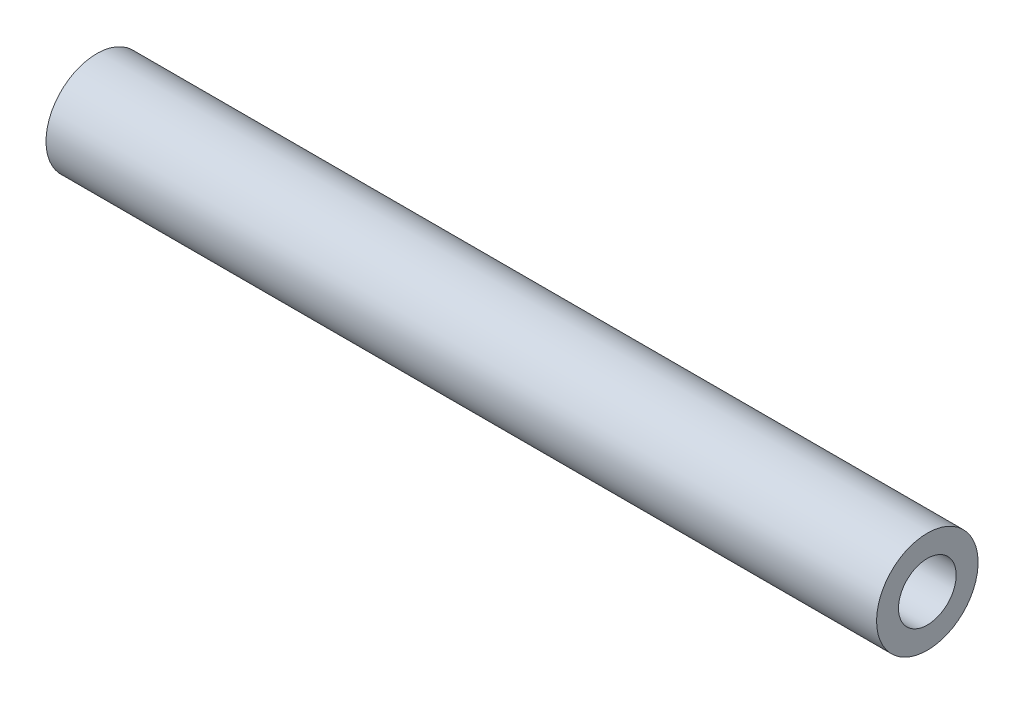
from build123d import *

# Parameters (mm, degrees)
SKETCH1_R           = 22
SKETCH1_R_2         = 12.5
BOSS_EXTRUDE1_DEPTH = 360


with BuildPart() as part:
    # Sketch1 → Boss-Extrude1 (new body)
    with BuildSketch(Plane(origin=(0, 0, 0), x_dir=(0, 0, -1), z_dir=(1, 0, 0))):
        Circle(SKETCH1_R)
        Circle(SKETCH1_R_2, mode=Mode.SUBTRACT)
    extrude(amount=BOSS_EXTRUDE1_DEPTH)


solid = part.part
